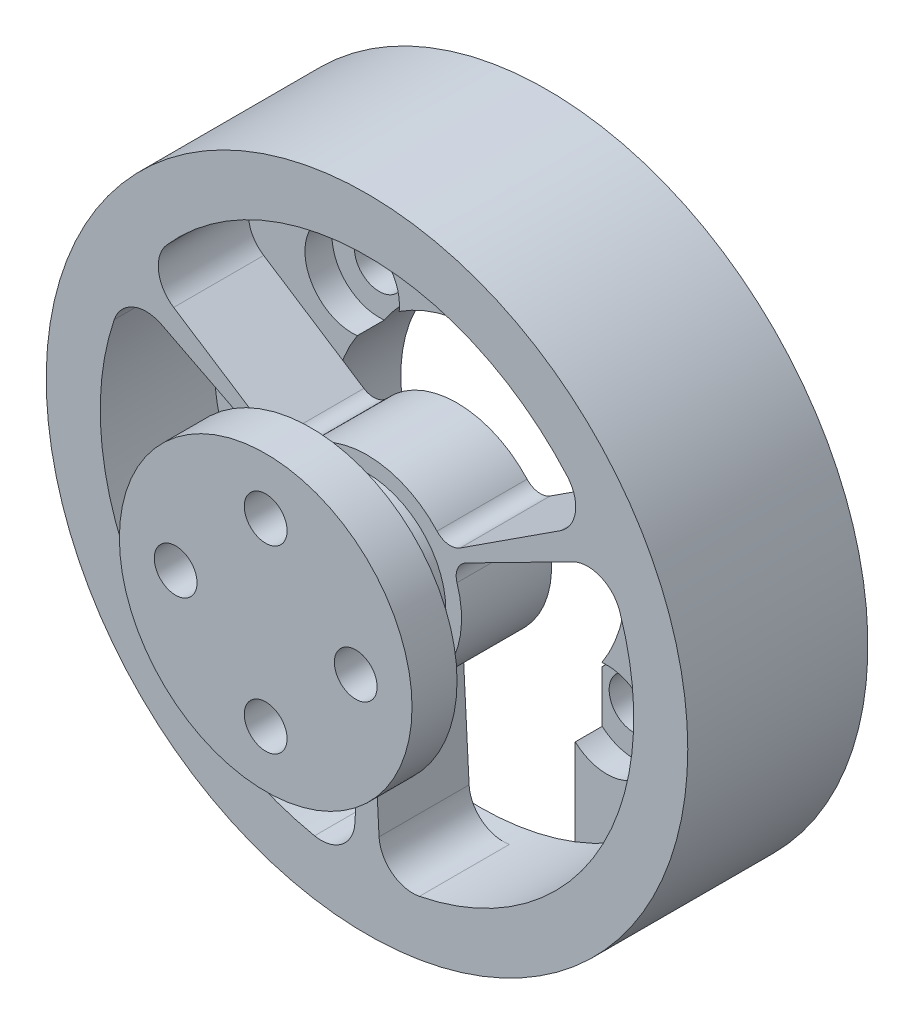
from build123d import *
from build123d.topology import SkipClean

# Parameters (mm, degrees)
SKETCH_1_R          = 1.1
EXTRUDE_1_DEPTH     = 3
SKETCH_2_R          = 2.1
CUT_EXTRUDE_1_DEPTH = 1.2
SKETCH_3_R          = 14.25
SKETCH_3_R_2        = 11.85
EXTRUDE_2_DEPTH     = 1
SKETCH_4_R          = 14.25
EXTRUDE_3_DEPTH     = 4
SKETCH_5_R          = 3.25
CUT_EXTRUDE_2_DEPTH = 2.5
SKETCH_6_R          = 3.5
EXTRUDE_4_DEPTH     = 2.5
SKETCH_11_R         = 6.5
SKETCH_11_R_2       = 0.95
EXTRUDE_6_DEPTH     = 2


with BuildPart() as part:
    # 스케치1 → 보스-돌출1 (new body)
    with BuildSketch(Plane.XY):
        with BuildLine():
            Line((-4.25, -4.918078893), (-4.25, -13.601470509))
            ThreePointArc((-4.25, -13.601470509), (0, 14.25), (4.25, -13.601470509))
            Line((4.25, -13.601470509), (4.25, -4.918078893))
            ThreePointArc((4.25, -4.918078893), (0, 6.5), (-4.25, -4.918078893))
        make_face()
        with Locations((5.656854249, 5.656854249)):
            Circle(SKETCH_1_R, mode=Mode.SUBTRACT)
        with Locations((5.656854249, -5.656854249)):
            Circle(SKETCH_1_R, mode=Mode.SUBTRACT)
        with Locations((-5.656854249, -5.656854249)):
            Circle(SKETCH_1_R, mode=Mode.SUBTRACT)
        with Locations((-5.656854249, 5.656854249)):
            Circle(SKETCH_1_R, mode=Mode.SUBTRACT)
    extrude(amount=EXTRUDE_1_DEPTH)

    # 스케치2 → 컷-돌출1 (cut)
    with BuildSketch(Plane.XY.offset(3)):
        with Locations((-5.656854249, 5.656854249)):
            Circle(SKETCH_2_R)
        with Locations((5.656854249, 5.656854249)):
            Circle(SKETCH_2_R)
        with Locations((5.656854249, -5.656854249)):
            Circle(SKETCH_2_R)
        with Locations((-5.656854249, -5.656854249)):
            Circle(SKETCH_2_R)
    extrude(amount=-CUT_EXTRUDE_1_DEPTH, mode=Mode.SUBTRACT)

    # 스케치3 → 보스-돌출2 (add)
    with SkipClean():  # the faces are left unmerged after this step: merging them gives an invalid solid
        with BuildSketch(Plane.XY.offset(3)):
            Circle(SKETCH_3_R)
            Circle(SKETCH_3_R_2, mode=Mode.SUBTRACT)
        extrude(amount=EXTRUDE_2_DEPTH)

    # 스케치4 → 보스-돌출3 (add)
    with SkipClean():  # the faces are left unmerged after this step: merging them gives an invalid solid
        with BuildSketch(Plane.XY.offset(4)):
            Circle(SKETCH_4_R)
            with BuildLine():
                Line((-8.58859676, 5.577499951), (-4.139329935, 2.688112291))
                ThreePointArc((-4.139329935, 2.688112291), (-3.600629974, 2.565705616), (-3.111039714, 2.821600946))
                ThreePointArc((-3.111039714, 2.821600946), (0, 4.2), (3.111039714, 2.821600946))
                ThreePointArc((3.111039714, 2.821600946), (3.600629974, 2.565705616), (4.139329935, 2.688112291))
                Line((4.139329935, 2.688112291), (8.58859676, 5.577499951))
                ThreePointArc((8.58859676, 5.577499951), (9.257640836, 6.631064641), (8.897962585, 7.826158817))
                ThreePointArc((8.897962585, 7.826158817), (0, 11.85), (-8.897962585, 7.826158817))
                ThreePointArc((-8.897962585, 7.826158817), (-9.257640836, 6.631064641), (-8.58859676, 5.577499951))
            make_face(mode=Mode.SUBTRACT)
            with BuildLine():
                Line((0.535958267, -10.226692952), (0.258308564, -4.928821024))
                ThreePointArc((0.258308564, -4.928821024), (0.421651255, -4.401089835), (0.888058241, -4.105039897))
                ThreePointArc((0.888058241, -4.105039897), (3.637306696, -2.1), (3.999097955, 1.283438952))
                ThreePointArc((3.999097955, 1.283438952), (4.022281229, 1.835384219), (4.3976385, 2.240708733))
                Line((4.3976385, 2.240708733), (9.124555027, 4.649193001))
                ThreePointArc((9.124555027, 4.649193001), (10.371490851, 4.701819822), (11.226633642, 3.792782232))
                ThreePointArc((11.226633642, 3.792782232), (10.262401035, -5.925), (2.328671057, -11.618941049))
                ThreePointArc((2.328671057, -11.618941049), (1.113850016, -11.332884463), (0.535958267, -10.226692952))
            make_face(mode=Mode.SUBTRACT)
            with BuildLine():
                Line((-9.124555027, 4.649193001), (-4.3976385, 2.240708733))
                ThreePointArc((-4.3976385, 2.240708733), (-4.022281229, 1.835384219), (-3.999097955, 1.283438952))
                ThreePointArc((-3.999097955, 1.283438952), (-3.637306696, -2.1), (-0.888058241, -4.105039897))
                ThreePointArc((-0.888058241, -4.105039897), (-0.421651255, -4.401089835), (-0.258308564, -4.928821024))
                Line((-0.258308564, -4.928821024), (-0.535958267, -10.226692952))
                ThreePointArc((-0.535958267, -10.226692952), (-1.113850016, -11.332884463), (-2.328671057, -11.618941049))
                ThreePointArc((-2.328671057, -11.618941049), (-10.262401035, -5.925), (-11.226633642, 3.792782232))
                ThreePointArc((-11.226633642, 3.792782232), (-10.371490851, 4.701819822), (-9.124555027, 4.649193001))
            make_face(mode=Mode.SUBTRACT)
        extrude(amount=EXTRUDE_3_DEPTH)

    # 스케치5 → 컷-돌출2 (cut)
    with SkipClean():  # the faces are left unmerged after this step: merging them gives an invalid solid
        with BuildSketch(Plane(origin=(0, 0, 4), x_dir=(-1, 0, 0), z_dir=(0, 0, -1))):
            Circle(SKETCH_5_R)
        extrude(amount=-CUT_EXTRUDE_2_DEPTH, mode=Mode.SUBTRACT)

    # 스케치6 → 보스-돌출4 (add)
    with SkipClean():  # the faces are left unmerged after this step: merging them gives an invalid solid
        with BuildSketch(Plane.XY.offset(8)):
            Circle(SKETCH_6_R)
        extrude(amount=EXTRUDE_4_DEPTH)

    # 스케치11 → 보스-돌출6 (add)
    with SkipClean():  # the faces are left unmerged after this step: merging them gives an invalid solid
        with BuildSketch(Plane.XY.offset(10.5)):
            Circle(SKETCH_11_R)
            with Locations((0, 4)):
                Circle(SKETCH_11_R_2, mode=Mode.SUBTRACT)
            with Locations((4, 0)):
                Circle(SKETCH_11_R_2, mode=Mode.SUBTRACT)
            with Locations((0, -4)):
                Circle(SKETCH_11_R_2, mode=Mode.SUBTRACT)
            with Locations((-4, 0)):
                Circle(SKETCH_11_R_2, mode=Mode.SUBTRACT)
        extrude(amount=EXTRUDE_6_DEPTH)


solid = part.part
